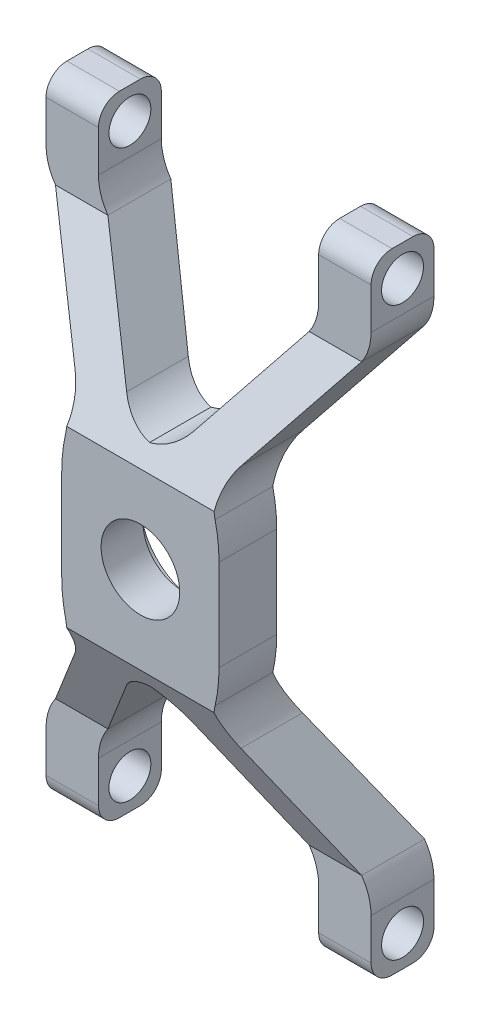
from build123d import *

# Parameters (mm, degrees)
BOSS_EXTRUDE1_DEPTH     = 30
CUT_EXTRUDE1_DEPTH      = 74.898579147
CUT_EXTRUDE1_DEPTH_BACK = 74.898579147
FILLET1_R               = 10
FILLET2_R               = 30
CUT_EXTRUDE2_DEPTH      = 73.01388755
CUT_EXTRUDE2_DEPTH_BACK = 73.01388755
FILLET3_R               = 10
SKETCH4_R               = 4
CUT_EXTRUDE3_DEPTH      = 90.827612681
FILLET4_R               = 4
SKETCH5_R               = 11
SKETCH5_R_2             = 7.5
CUT_EXTRUDE4_DEPTH      = 3
SKETCH5_2_R             = 7.5
CUT_EXTRUDE6_DEPTH      = 69.971008402


with BuildPart() as part:
    # Sketch1 → Boss-Extrude1 (new body)
    with BuildSketch(Plane.XY):
        with BuildLine():
            Line((-21, 48.152987889), (-21, 60))
            Line((-21, 60), (-31, 60))
            Line((-31, 60), (-31, 48.152987889))
            ThreePointArc((-31, 48.152987889), (-30.537169507, 45.145929894), (-29.191520443, 42.417223525))
            Line((-29.191520443, 42.417223525), (-11.127260537, 16.618786747))
            ThreePointArc((-11.127260537, 16.618786747), (-13.173135996, 15.048869992), (-15, 13.228756555))
            Line((-15, 13.228756555), (-15, 0))
            Line((-15, 0), (15, 0))
            Line((15, 0), (15, 13.228756555))
            ThreePointArc((15, 13.228756555), (13.173135996, 15.048869992), (11.127260537, 16.618786747))
            Line((11.127260537, 16.618786747), (29.191520443, 42.417223525))
            ThreePointArc((29.191520443, 42.417223525), (30.537169507, 45.145929894), (31, 48.152987889))
            Line((31, 48.152987889), (31, 60))
            Line((31, 60), (21, 60))
            Line((21, 60), (21, 48.152987889))
            ThreePointArc((21, 48.152987889), (20.537169507, 45.145929894), (19.191520443, 42.417223525))
            Line((19.191520443, 42.417223525), (3.302564109, 19.725442208))
            ThreePointArc((3.302564109, 19.725442208), (0, 20), (-3.302564109, 19.725442208))
            Line((-3.302564109, 19.725442208), (-19.191520443, 42.417223525))
            ThreePointArc((-19.191520443, 42.417223525), (-20.537169507, 45.145929894), (-21, 48.152987889))
        make_face()
    extrude(amount=BOSS_EXTRUDE1_DEPTH)

    # Sketch2 → Cut-Extrude1 (cut, two sides: drawn at the far end of the back side and taken through both)
    with BuildSketch(Plane(origin=(0, 0, 0), x_dir=(0, 0, -1), z_dir=(1, 0, 0)).offset(-CUT_EXTRUDE1_DEPTH_BACK)):
        Polygon((-25, 0), (-25, 16.618786747), (-12, 42.417223525), (-12, 60), (-30, 60), (-30, 0), align=None)
    extrude(amount=CUT_EXTRUDE1_DEPTH + CUT_EXTRUDE1_DEPTH_BACK, mode=Mode.SUBTRACT)

    # Fillet1
    # the kernel refuses this fillet: 10 mm, written as the material it adds along each edge
    with BuildSketch(Plane(origin=(11.127260537, 16.618786747, 0), x_dir=(0.75244349959859, -0.6586567997916871, 0), z_dir=(0, 0, 1))) as fillet1_piece_1_section:
        with BuildLine():
            CenterArc((9.059445237, 9.202818325), FILLET1_R, 186.19751299, 60.769805767)
            Line((-0.882111272, 8.123256295), (-1.080942402, 8.101665055))
            Line((-1.080942402, 8.101665055), (-0.19883113, -0.021591241))
            Line((-0.19883113, -0.021591241), (0.02573442, -0.198337439))
            ThreePointArc((0.02573442, -0.198337439), (2.573442036, -0.033743875), (5.068632849, -0.184056367))
            Line((5.068632849, -0.184056367), (5.146884072, 0))
        make_face()
    fillet1_piece_1 = extrude(amount=25, mode=Mode.PRIVATE)
    fillet1_piece_1 = split(fillet1_piece_1, bisect_by=Plane(origin=(13.208648134, 22.312499117, 22.130901324), z_dir=(0, -0.4500023080786392, -0.8930273919224972)), keep=Keep.TOP, mode=Mode.PRIVATE)
    add(fillet1_piece_1)
    with BuildSketch(Plane(origin=(-11.127260537, 16.618786747, 0), x_dir=(-0.573576436351047, 0.819152044288991, 0), z_dir=(0, 0, 1))) as fillet1_piece_2_section:
        with BuildLine():
            CenterArc((8.171010533, 10), FILLET1_R, 209.230194233, 60.769805767)
            Line((-0.555638062, 5.116803885), (-0.730171033, 5.019139963))
            ThreePointArc((-0.730171033, 5.019139963), (-0.311365695, 2.554759082), (-0.199956476, 0.004172263))
            Line((-0.199956476, 0.004172263), (0, -0.2))
            Line((0, -0.2), (8.171010533, -0.2))
            Line((8.171010533, -0.2), (8.171010533, 0))
        make_face()
    fillet1_piece_2 = extrude(amount=25, mode=Mode.PRIVATE)
    fillet1_piece_2 = split(fillet1_piece_2, bisect_by=Plane(origin=(-15.334467923, 27.154175935, 19.691148901), z_dir=(0, -0.4500023080786392, -0.8930273919224972)), keep=Keep.TOP, mode=Mode.PRIVATE)
    add(fillet1_piece_2)

    # Fillet2
    fillet2_edges = [part.edges().sort_by_distance(p)[0] for p in [
        (-15, 13.228756555, 12.5),
        (15, 13.228756555, 12.5),
    ]]
    fillet(fillet2_edges, radius=FILLET2_R)

    # Sketch3 → Cut-Extrude2 (cut, two sides: drawn at the far end of the back side and taken through both)
    with BuildSketch(Plane(origin=(0, 0, 0), x_dir=(0, 0, -1), z_dir=(1, 0, 0)).offset(-CUT_EXTRUDE2_DEPTH_BACK)):
        Polygon((-14, 0), (-14, 15.360293774), (0, 42.417223525), (0, 0), align=None)
    extrude(amount=CUT_EXTRUDE2_DEPTH + CUT_EXTRUDE2_DEPTH_BACK, mode=Mode.SUBTRACT)

    # Fillet3
    # the kernel refuses this fillet: 10 mm, written as the material it adds along each edge
    with BuildSketch(Plane(origin=(3.302564109, 19.725442208, -1.95547457), x_dir=(-0.9985520834372477, 0.053793463014867454, 0), z_dir=(0, 0, 1))) as fillet3_piece_1_section:
        with BuildLine():
            CenterArc((5.591706065, -9.937268887), FILLET3_R, 96.421055445, 51.662571373)
            Line((-2.896500368, -4.650459684), (0, 0))
            ThreePointArc((0, 0), (2.236682426, -0.125462226), (4.473364852, 0))
        make_face()
    fillet3_piece_1 = extrude(amount=39.086837339, mode=Mode.PRIVATE)
    fillet3_piece_1 = split(fillet3_piece_1, bisect_by=Plane(origin=(3.109386203, 18.47326219, 12.38926448), z_dir=(0, 0.45955333907229245, 0.888150172294926)), keep=Keep.TOP, mode=Mode.PRIVATE)
    fillet3_piece_1 = split(fillet3_piece_1, bisect_by=Plane(origin=(3.109386203, 23.215327511, 21.675960227), z_dir=(0, -0.4500023080791268, -0.8930273919222517)), keep=Keep.TOP, mode=Mode.PRIVATE)
    add(fillet3_piece_1)
    with BuildSketch(Plane(origin=(-3.302564109, 19.725442208, -1.95547457), x_dir=(-0.5735764363510474, 0.8191520442889909, 0), z_dir=(0, 0, 1))) as fillet3_piece_2_section:
        with BuildLine():
            CenterArc((5.47873066, -10), FILLET3_R, 90, 51.662571373)
            ThreePointArc((-2.364982647, -3.797084431), (-1.075996396, -1.964871701), (0, 0))
            Line((0, 0), (5.47873066, 0))
        make_face()
    fillet3_piece_2 = extrude(amount=39.086837339, mode=Mode.PRIVATE)
    fillet3_piece_2 = split(fillet3_piece_2, bisect_by=Plane(origin=(-3.109386203, 18.47326219, 12.38926448), z_dir=(0, 0.45955333907229245, 0.888150172294926)), keep=Keep.TOP, mode=Mode.PRIVATE)
    fillet3_piece_2 = split(fillet3_piece_2, bisect_by=Plane(origin=(-3.109386203, 23.215327511, 21.675960227), z_dir=(0, -0.4500023080791268, -0.8930273919222517)), keep=Keep.TOP, mode=Mode.PRIVATE)
    add(fillet3_piece_2)

    # Sketch4 → Cut-Extrude3 (cut, through all)
    with BuildSketch(Plane(origin=(31, 0, 0), x_dir=(0, 0, -1), z_dir=(1, 0, 0))):
        with Locations((-6, 54.076493944)):
            Circle(SKETCH4_R)
    extrude(amount=-CUT_EXTRUDE3_DEPTH, mode=Mode.SUBTRACT)

    # Fillet4
    fillet4_edges = [part.edges().sort_by_distance(p)[0] for p in [
        (-26, 60, 0),
        (26, 60, 0),
        (26, 60, 12),
        (-26, 60, 12),
    ]]
    fillet(fillet4_edges, radius=FILLET4_R)

    # Mirror2: part across plane


with BuildPart() as part_1:
    add(part.part)
    add(part.part.mirror(Plane(origin=(0, 0, 30), x_dir=(0, 0, 1), z_dir=(0, 1, 0))))

    # Sketch5 → Cut-Extrude4 (cut)
    with BuildSketch(Plane(origin=(0, 0, 14), x_dir=(-1, 0, 0), z_dir=(0, 0, -1))):
        Circle(SKETCH5_R)
        Circle(SKETCH5_R_2, mode=Mode.SUBTRACT)
    extrude(amount=-CUT_EXTRUDE4_DEPTH, mode=Mode.SUBTRACT)

    # Sketch5<2> → Cut-Extrude6 (cut, through all)
    with BuildSketch(Plane(origin=(0, 0, 14), x_dir=(-1, 0, 0), z_dir=(0, 0, -1))):
        Circle(SKETCH5_2_R)
    extrude(amount=-CUT_EXTRUDE6_DEPTH, mode=Mode.SUBTRACT)


solid = part_1.part
